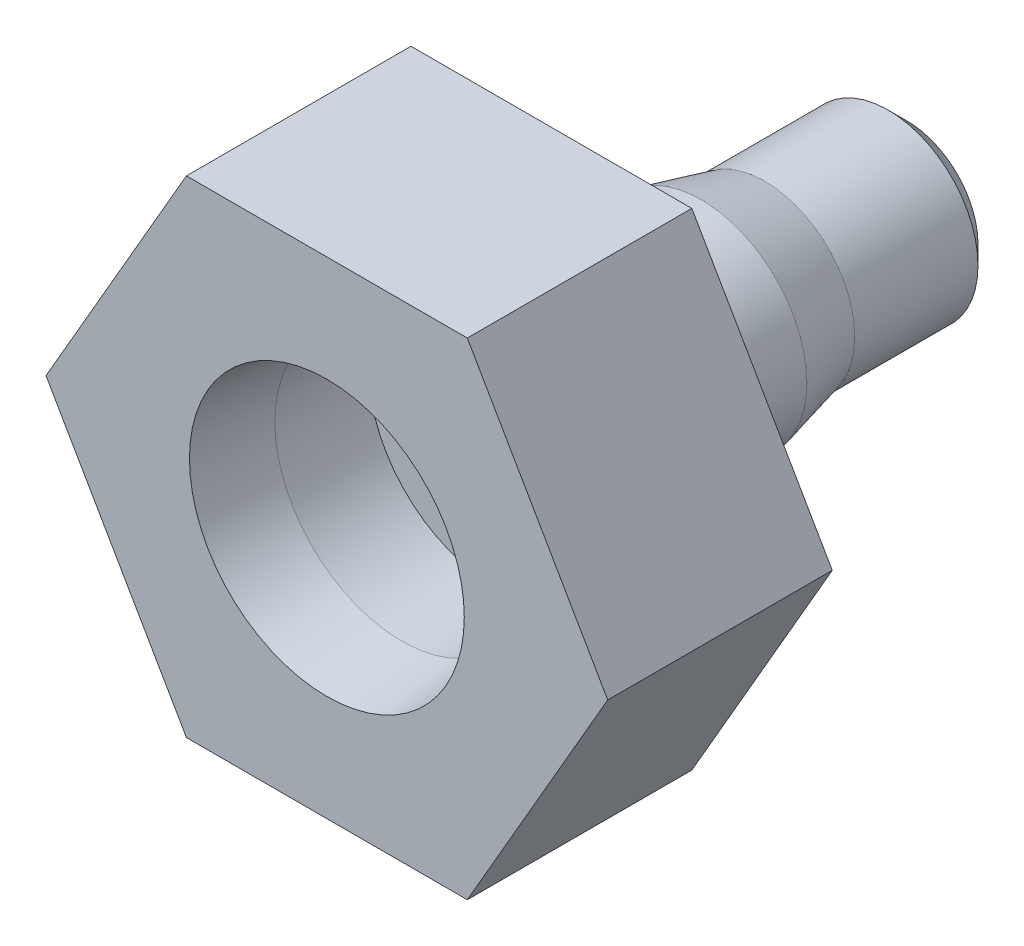
from build123d import *

# Parameters (mm, degrees)
SKETCH1_R           = 2.825
BOSS_EXTRUDE1_DEPTH = 9.5
SKETCH2_R           = 6.5
BOSS_EXTRUDE2_DEPTH = 6
SKETCH3_R           = 0.85
CUT_EXTRUDE1_DEPTH  = 15.5
SKETCH4_R           = 2.5
CUT_EXTRUDE2_DEPTH  = 4
CHAMFER1_SIZE       = 1
SKETCH10_R          = 0.85
BOSS_EXTRUDE5_DEPTH = 6
SKETCH11_R          = 2.825
SKETCH11_R_2        = 2.4
CUT_EXTRUDE3_DEPTH  = 6
CHAMFER2_SIZE       = 0.55
CHAMFER2_SIZE_2     = 2.205929513
CHAMFER3_SIZE       = 0.5
SKETCH12_R          = 3.3909
CUT_EXTRUDE4_DEPTH  = 4.5
CHAMFER4_SIZE       = 2
CHAMFER4_SIZE2      = 0.281081669


with BuildPart() as part:
    # Sketch1 → Boss-Extrude1 (new body)
    with BuildSketch(Plane.XY):
        Circle(SKETCH1_R)
    extrude(amount=BOSS_EXTRUDE1_DEPTH)

    # Sketch2 → Boss-Extrude2 (add)
    with BuildSketch(Plane.XY.offset(9.5)):
        Circle(SKETCH2_R)
    extrude(amount=BOSS_EXTRUDE2_DEPTH)

    # Sketch3 → Cut-Extrude1 (cut)
    with BuildSketch(Plane.XY.offset(15.5)):
        Circle(SKETCH3_R)
    extrude(amount=-CUT_EXTRUDE1_DEPTH, mode=Mode.SUBTRACT)

    # Sketch4 → Cut-Extrude2 (cut)
    with BuildSketch(Plane.XY.offset(15.5)):
        Circle(SKETCH4_R)
    extrude(amount=-CUT_EXTRUDE2_DEPTH, mode=Mode.SUBTRACT)

    # Chamfer1
    chamfer1_edges = [part.edges().sort_by_distance(p)[0] for p in [
        (-2.825, 0, 9.5),
    ]]
    chamfer(chamfer1_edges, length=CHAMFER1_SIZE)

    # Sketch10 → Boss-Extrude5 (add)
    with BuildSketch(Plane.XY.offset(15.5)):
        Polygon((3.75277675, 6.5), (-3.75277675, 6.5), (-7.505553499, 0), (-3.75277675, -6.5), (3.75277675, -6.5), (7.505553499, 0), align=None)
        Circle(SKETCH10_R, mode=Mode.SUBTRACT)
    extrude(amount=-BOSS_EXTRUDE5_DEPTH)

    # Sketch11 → Cut-Extrude3 (cut)
    with BuildSketch(Plane(origin=(0, 0, 0), x_dir=(-1, 0, 0), z_dir=(0, 0, -1))):
        with Locations(Location((0, 0, 0), (0, 0, 180))):
            Circle(SKETCH11_R)
        Circle(SKETCH11_R_2, mode=Mode.SUBTRACT)
    extrude(amount=-CUT_EXTRUDE3_DEPTH, mode=Mode.SUBTRACT)

    # Chamfer2
    # the kernel refuses this chamfer: 2.205929513, 0.55 mm, written as the material it adds along each edge
    with BuildSketch(Plane(origin=(0, 0, 6), x_dir=(-1, 0, 0), z_dir=(0, -1, 0))) as chamfer2_piece_1_section:
        Polygon((2.4 + CHAMFER2_SIZE, 0), (2.4, CHAMFER2_SIZE_2), (2.4, 0), align=None)
    chamfer2_piece_1 = revolve(axis=Axis((0, 0, 6), (0, 0, -1)), mode=Mode.PRIVATE)
    chamfer2_piece_1 = chamfer2_piece_1 & Plane(origin=(0, 0, 4.60896978), x_dir=(1, 0, 0), z_dir=(0, 0, -1)) * Cylinder(2.825, 12, mode=Mode.PRIVATE)
    add(chamfer2_piece_1)

    # Chamfer3
    chamfer3_edges = [part.edges().sort_by_distance(p)[0] for p in [
        (2.4, 0, 0),
    ]]
    chamfer(chamfer3_edges, length=CHAMFER3_SIZE)

    # Sketch12 → Cut-Extrude4 (cut)
    with BuildSketch(Plane.XY.offset(15.5)):
        Circle(SKETCH12_R)
    extrude(amount=-CUT_EXTRUDE4_DEPTH, mode=Mode.SUBTRACT)

    # Chamfer4
    chamfer4_edges = [part.edges().sort_by_distance(p)[0] for p in [
        (-3.3909, 0, 15.5),
    ]]
    chamfer4_side = [part.faces().sort_by_distance(p)[0] for p in [
        (-3.3909, 0, 13.25),
    ]]
    chamfer(chamfer4_edges, length=CHAMFER4_SIZE, length2=CHAMFER4_SIZE2, reference=chamfer4_side[0])


solid = part.part
